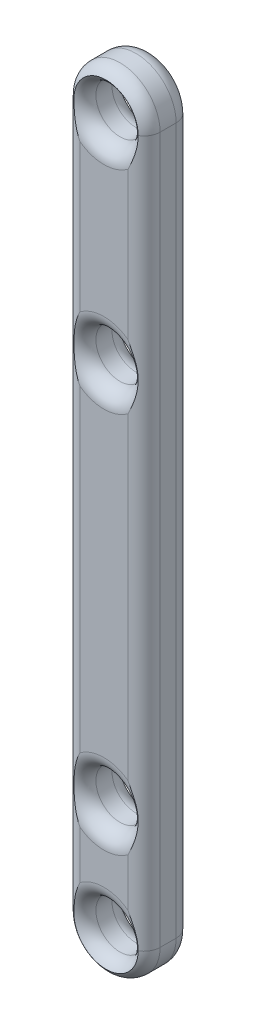
from build123d import *

# Parameters (mm, degrees)
SKETCH1_R           = 1.5
BOSS_EXTRUDE1_DEPTH = 3
FILLET1_R           = 1


with BuildPart() as part:
    # Sketch1 → Boss-Extrude1 (new body)
    with BuildSketch(Plane.XY):
        with BuildLine():
            Line((2.5, 0), (2.5, -44))
            ThreePointArc((2.5, -44), (0, -46.5), (-2.5, -44))
            Line((-2.5, -44), (-2.5, 0))
            ThreePointArc((-2.5, 0), (0, 2.5), (2.5, 0))
        make_face()
        Circle(SKETCH1_R, mode=Mode.SUBTRACT)
        with Locations((0, -13.2)):
            Circle(SKETCH1_R, mode=Mode.SUBTRACT)
        with Locations((0, -37)):
            Circle(SKETCH1_R, mode=Mode.SUBTRACT)
        with Locations((0, -44)):
            Circle(SKETCH1_R, mode=Mode.SUBTRACT)
    extrude(amount=BOSS_EXTRUDE1_DEPTH)

    # Fillet1
    # the kernel refuses this fillet: 1 mm, written as the material it takes off along each edge
    with BuildSketch(Plane(origin=(0, 0, 3), x_dir=(-1, 0, 0), z_dir=(0, -1, 0))) as fillet1_piece_1:
        with BuildLine():
            CenterArc((2.5 - FILLET1_R, FILLET1_R), FILLET1_R, 270, 90)
            Line((2.5 - FILLET1_R, 0), (2.5, 0))
            Line((2.5, 0), (2.5, FILLET1_R))
        make_face()
    revolve(axis=Axis((0, 0, 3), (0, 0, -1)), revolution_arc=180, mode=Mode.SUBTRACT)
    with BuildSketch(Plane(origin=(0, 0, 0), x_dir=(-1, 0, 0), z_dir=(0, -1, 0))) as fillet1_piece_2:
        with BuildLine():
            CenterArc((2.5 - FILLET1_R, -FILLET1_R), FILLET1_R, 0, 90)
            Line((2.5 - FILLET1_R, 0), (2.5, 0))
            Line((2.5, 0), (2.5, -FILLET1_R))
        make_face()
    revolve(axis=Axis((0, 0, 0), (0, 0, -1)), revolution_arc=180, mode=Mode.SUBTRACT)
    with BuildSketch(Plane(origin=(-2.5, -44, 3), x_dir=(0, 0, -1), z_dir=(0, 1, 0)), Plane(origin=(2.5, 0, 3), x_dir=(0, 0, -1), z_dir=(0, -1, 0))) as fillet1_piece_3:
        with BuildLine():
            CenterArc((FILLET1_R, -FILLET1_R), FILLET1_R, 90, 90)
            Line((0, -FILLET1_R), (0, 0))
            Line((0, 0), (FILLET1_R, 0))
        make_face()
    extrude(amount=44, mode=Mode.SUBTRACT)
    with BuildSketch(Plane(origin=(-2.5, -44, 0), x_dir=(0, 0, 1), z_dir=(0, 1, 0)), Plane(origin=(2.5, 0, 0), x_dir=(0, 0, 1), z_dir=(0, -1, 0))) as fillet1_piece_4:
        with BuildLine():
            CenterArc((FILLET1_R, FILLET1_R), FILLET1_R, 180, 90)
            Line((0, FILLET1_R), (0, 0))
            Line((0, 0), (FILLET1_R, 0))
        make_face()
    extrude(amount=44, mode=Mode.SUBTRACT)
    with BuildSketch(Plane(origin=(0, -44, 3), x_dir=(1, 0, 0), z_dir=(0, 1, 0))) as fillet1_piece_5:
        with BuildLine():
            CenterArc((2.5 - FILLET1_R, FILLET1_R), FILLET1_R, 270, 90)
            Line((2.5 - FILLET1_R, 0), (2.5, 0))
            Line((2.5, 0), (2.5, FILLET1_R))
        make_face()
    revolve(axis=Axis((0, -44, 3), (0, 0, -1)), revolution_arc=180, mode=Mode.SUBTRACT)
    with BuildSketch(Plane(origin=(0, -44, 0), x_dir=(1, 0, 0), z_dir=(0, 1, 0))) as fillet1_piece_6:
        with BuildLine():
            CenterArc((2.5 - FILLET1_R, -FILLET1_R), FILLET1_R, 0, 90)
            Line((2.5 - FILLET1_R, 0), (2.5, 0))
            Line((2.5, 0), (2.5, -FILLET1_R))
        make_face()
    revolve(axis=Axis((0, -44, 0), (0, 0, -1)), revolution_arc=180, mode=Mode.SUBTRACT)
    with BuildSketch(Plane(origin=(0, 0, 0), x_dir=(1, 0, 0), z_dir=(0, -1, 0))) as fillet1_piece_7:
        with BuildLine():
            CenterArc((1.5 + FILLET1_R, FILLET1_R), FILLET1_R, 180, 90)
            Line((1.5 + FILLET1_R, 0), (1.5, 0))
            Line((1.5, 0), (1.5, FILLET1_R))
        make_face()
    revolve(axis=Axis((0, 0, 0), (0, 0, 1)), mode=Mode.SUBTRACT)
    with BuildSketch(Plane(origin=(0, 0, 3), x_dir=(1, 0, 0), z_dir=(0, -1, 0))) as fillet1_piece_8:
        with BuildLine():
            CenterArc((1.5 + FILLET1_R, -FILLET1_R), FILLET1_R, 90, 90)
            Line((1.5 + FILLET1_R, 0), (1.5, 0))
            Line((1.5, 0), (1.5, -FILLET1_R))
        make_face()
    revolve(axis=Axis((0, 0, 3), (0, 0, 1)), mode=Mode.SUBTRACT)
    with BuildSketch(Plane(origin=(0, -13.2, 0), x_dir=(1, 0, 0), z_dir=(0, -1, 0))) as fillet1_piece_9:
        with BuildLine():
            CenterArc((1.5 + FILLET1_R, FILLET1_R), FILLET1_R, 180, 90)
            Line((1.5 + FILLET1_R, 0), (1.5, 0))
            Line((1.5, 0), (1.5, FILLET1_R))
        make_face()
    revolve(axis=Axis((0, -13.2, 0), (0, 0, 1)), mode=Mode.SUBTRACT)
    with BuildSketch(Plane(origin=(0, -13.2, 3), x_dir=(1, 0, 0), z_dir=(0, -1, 0))) as fillet1_piece_10:
        with BuildLine():
            CenterArc((1.5 + FILLET1_R, -FILLET1_R), FILLET1_R, 90, 90)
            Line((1.5 + FILLET1_R, 0), (1.5, 0))
            Line((1.5, 0), (1.5, -FILLET1_R))
        make_face()
    revolve(axis=Axis((0, -13.2, 3), (0, 0, 1)), mode=Mode.SUBTRACT)
    with BuildSketch(Plane(origin=(0, -37, 0), x_dir=(1, 0, 0), z_dir=(0, -1, 0))) as fillet1_piece_11:
        with BuildLine():
            CenterArc((1.5 + FILLET1_R, FILLET1_R), FILLET1_R, 180, 90)
            Line((1.5 + FILLET1_R, 0), (1.5, 0))
            Line((1.5, 0), (1.5, FILLET1_R))
        make_face()
    revolve(axis=Axis((0, -37, 0), (0, 0, 1)), mode=Mode.SUBTRACT)
    with BuildSketch(Plane(origin=(0, -37, 3), x_dir=(1, 0, 0), z_dir=(0, -1, 0))) as fillet1_piece_12:
        with BuildLine():
            CenterArc((1.5 + FILLET1_R, -FILLET1_R), FILLET1_R, 90, 90)
            Line((1.5 + FILLET1_R, 0), (1.5, 0))
            Line((1.5, 0), (1.5, -FILLET1_R))
        make_face()
    revolve(axis=Axis((0, -37, 3), (0, 0, 1)), mode=Mode.SUBTRACT)
    with BuildSketch(Plane(origin=(0, -44, 0), x_dir=(1, 0, 0), z_dir=(0, -1, 0))) as fillet1_piece_13:
        with BuildLine():
            CenterArc((1.5 + FILLET1_R, FILLET1_R), FILLET1_R, 180, 90)
            Line((1.5 + FILLET1_R, 0), (1.5, 0))
            Line((1.5, 0), (1.5, FILLET1_R))
        make_face()
    revolve(axis=Axis((0, -44, 0), (0, 0, 1)), mode=Mode.SUBTRACT)
    with BuildSketch(Plane(origin=(0, -44, 3), x_dir=(1, 0, 0), z_dir=(0, -1, 0))) as fillet1_piece_14:
        with BuildLine():
            CenterArc((1.5 + FILLET1_R, -FILLET1_R), FILLET1_R, 90, 90)
            Line((1.5 + FILLET1_R, 0), (1.5, 0))
            Line((1.5, 0), (1.5, -FILLET1_R))
        make_face()
    revolve(axis=Axis((0, -44, 3), (0, 0, 1)), mode=Mode.SUBTRACT)


solid = part.part
